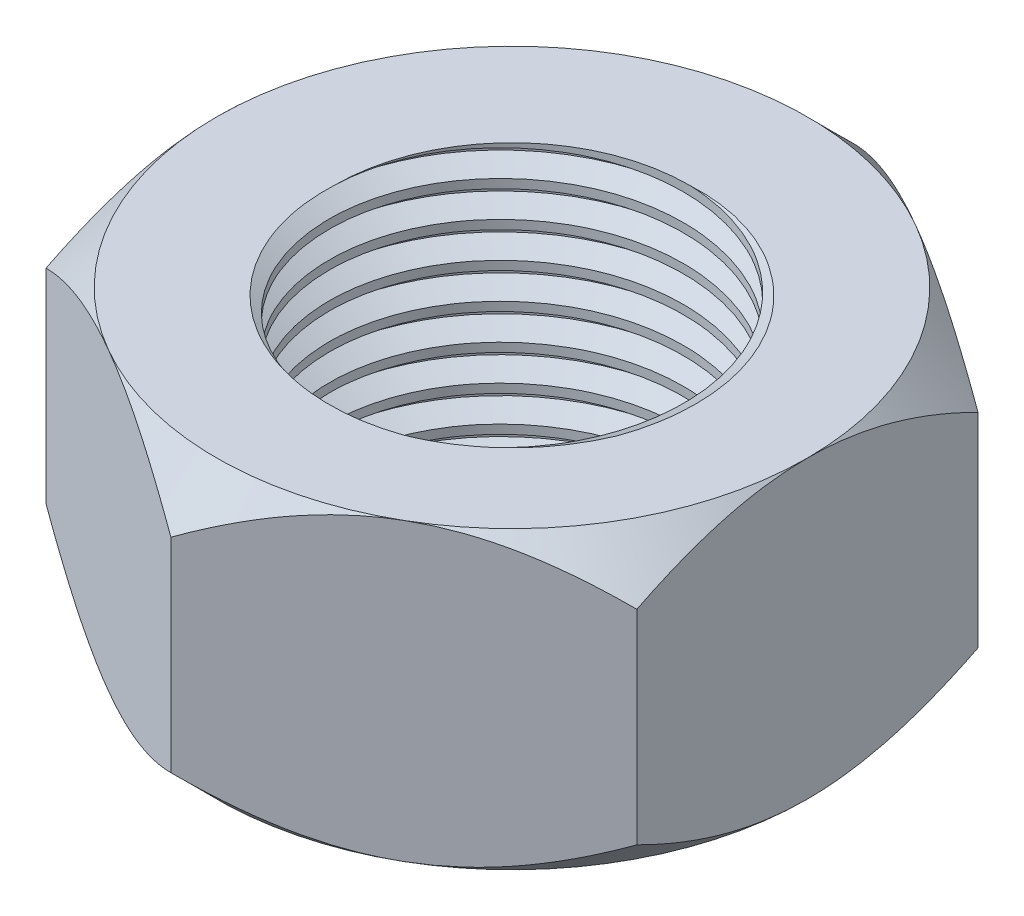
from build123d import *

# Parameters (mm, degrees)
SKETCH1_R               = 2.5
BOSS_EXTRUDE1_DEPTH     = 2.083333333
SKETCH3_OUTSIDE_W       = 18.012
SKETCH3_OUTSIDE_H       = 19.3
SKETCH3_OUTSIDE_R       = 4.166666667
CUT_EXTRUDE5_DEPTH      = 2.5
CUT_EXTRUDE5_DRAFT      = -45
MIRROR1_COPY_1_SKETCH_W = 18.012
MIRROR1_COPY_1_SKETCH_H = 19.3
MIRROR1_COPY_1_SKETCH_R = 4.166666667
MIRROR1_COPY_1_DEPTH    = 2.5
MIRROR1_COPY_1_DRAFT    = -45
THREAD1_PITCH           = 0.5


with BuildPart() as part:
    # Sketch1 → Boss-Extrude1 (new, symmetric)
    with BuildSketch(Plane(origin=(0, 0, 0), x_dir=(1, 0, 0), z_dir=(0, 1, 0))):
        Polygon((0, 4.811252243), (-4.166666667, 2.405626122), (-4.166666667, -2.405626122), (0, -4.811252243), (4.166666667, -2.405626122), (4.166666667, 2.405626122), align=None)
        with Locations(Location((0, 0, 0), (0, 0, 270))):
            Circle(SKETCH1_R, mode=Mode.SUBTRACT)
    extrude(amount=BOSS_EXTRUDE1_DEPTH, both=True)


with BuildPart() as cut_extrude5_tool:
    # Sketch3 outside → Cut-Extrude5 (with draft: the straight prism first)
    with BuildSketch(Plane(origin=(0, 2.083333333, 0), x_dir=(1, 0, 0), z_dir=(0, 1, 0))):
        Rectangle(SKETCH3_OUTSIDE_W, SKETCH3_OUTSIDE_H)
        Circle(SKETCH3_OUTSIDE_R, mode=Mode.SUBTRACT)
    extrude(amount=-CUT_EXTRUDE5_DEPTH)
    # Cut-Extrude5: the draft: its side faces are tilted about the plane it starts from
    cut_extrude5_sides = [cut_extrude5_tool.faces().sort_by_distance(p)[0] for p in [
        (0, 0.833333333, 9.65),
        (9.006, 0.833333333, 0),
        (0, 0.833333333, -9.65),
        (-9.006, 0.833333333, 0),
        (-4.166666667, 0.833333333, 0),
    ]]
    draft(cut_extrude5_sides, Plane(origin=(0, 2.083333333, 0), x_dir=(1, 0, 0), z_dir=(0, 1, 0)), CUT_EXTRUDE5_DRAFT)


with BuildPart() as part_1:
    add(part.part)

    # Cut-Extrude5: cut by cut_extrude5_tool
    add(cut_extrude5_tool.part, mode=Mode.SUBTRACT)


with BuildPart() as mirror1_copy_1_tool:
    # Mirror1 copy 1 sketch → Mirror1 copy 1 (with draft: the straight prism first)
    with BuildSketch(Plane.XZ.offset(2.083333333)):
        Rectangle(MIRROR1_COPY_1_SKETCH_W, MIRROR1_COPY_1_SKETCH_H)
        Circle(MIRROR1_COPY_1_SKETCH_R, mode=Mode.SUBTRACT)
    extrude(amount=-MIRROR1_COPY_1_DEPTH)
    # Mirror1 copy 1: the draft: its side faces are tilted about the plane it starts from
    mirror1_copy_1_sides = [mirror1_copy_1_tool.faces().sort_by_distance(p)[0] for p in [
        (0, -0.833333333, 9.65),
        (9.006, -0.833333333, 0),
        (0, -0.833333333, -9.65),
        (-9.006, -0.833333333, 0),
        (-4.166666667, -0.833333333, 0),
    ]]
    draft(mirror1_copy_1_sides, Plane.XZ.offset(2.083333333), MIRROR1_COPY_1_DRAFT)


with BuildPart() as part_2:
    add(part_1.part)

    # Mirror1 copy 1: cut by mirror1_copy_1_tool
    add(mirror1_copy_1_tool.part, mode=Mode.SUBTRACT)

    # Thread1: the profile of Thread Profile1 profile screwed along a right-hand helix of 20 turns, 6 arcs to a turn; built about Z, then put on its axis
    thread1_z = Axis((0, 0, 0), (0, 0, 1))
    thread1_corners = [(2.4997, 0, -0.000173205), (2.770632937, 0, 0.156249999), (2.770632937, 0, 0.218749999), (2.4997, 0, 0.375173203)]
    with BuildLine(mode=Mode.PRIVATE) as thread1_profile:
        Line(thread1_corners[0], thread1_corners[1])
        Line(thread1_corners[1], thread1_corners[2])
        Line(thread1_corners[2], thread1_corners[3])
        Line(thread1_corners[3], thread1_corners[0])
    thread1_cap = Face(thread1_profile.wire())
    thread1_turn_angles = [0, 30, 60, 90, 120, 150, 180, 210, 240, 270, 300, 330, 360]
    thread1_turn_weights = [1, 0.8660254037844387, 1, 0.8660254037844387, 1, 0.8660254037844387, 1, 0.8660254037844387, 1, 0.8660254037844387, 1, 0.8660254037844387, 1]
    thread1_turn_rails = [Edge.make_bspline([Vector(p[0], p[1], 0).rotate(thread1_z, thread1_turn_angles[k]) / thread1_turn_weights[k] + Vector(0, 0, p[2] + THREAD1_PITCH * thread1_turn_angles[k] / 360) for k in range(13)], [0, 0, 0, 1, 1, 2, 2, 3, 3, 4, 4, 5, 5, 6, 6, 6], 2, thread1_turn_weights) for p in thread1_corners]
    thread1_turn_sides = [Face.make_surface_from_curves(thread1_turn_rails[p[0]], thread1_turn_rails[p[1]]) for p in [(0, 1), (1, 2), (2, 3), (3, 0)]]
    thread1 = Plane(origin=(0, 7.083333333, 0), x_dir=(-1, 0, 0), z_dir=(0, -1, 0)) * Solid(Shell([*[p.moved(Location((0, 0, THREAD1_PITCH * i))) for i in range(20) for p in thread1_turn_sides], thread1_cap, thread1_cap.rotate(thread1_z, 7200).moved(Location((0, 0, THREAD1_PITCH * 7200 / 360)))]))
    add(thread1, mode=Mode.SUBTRACT)


solid = part_2.part
